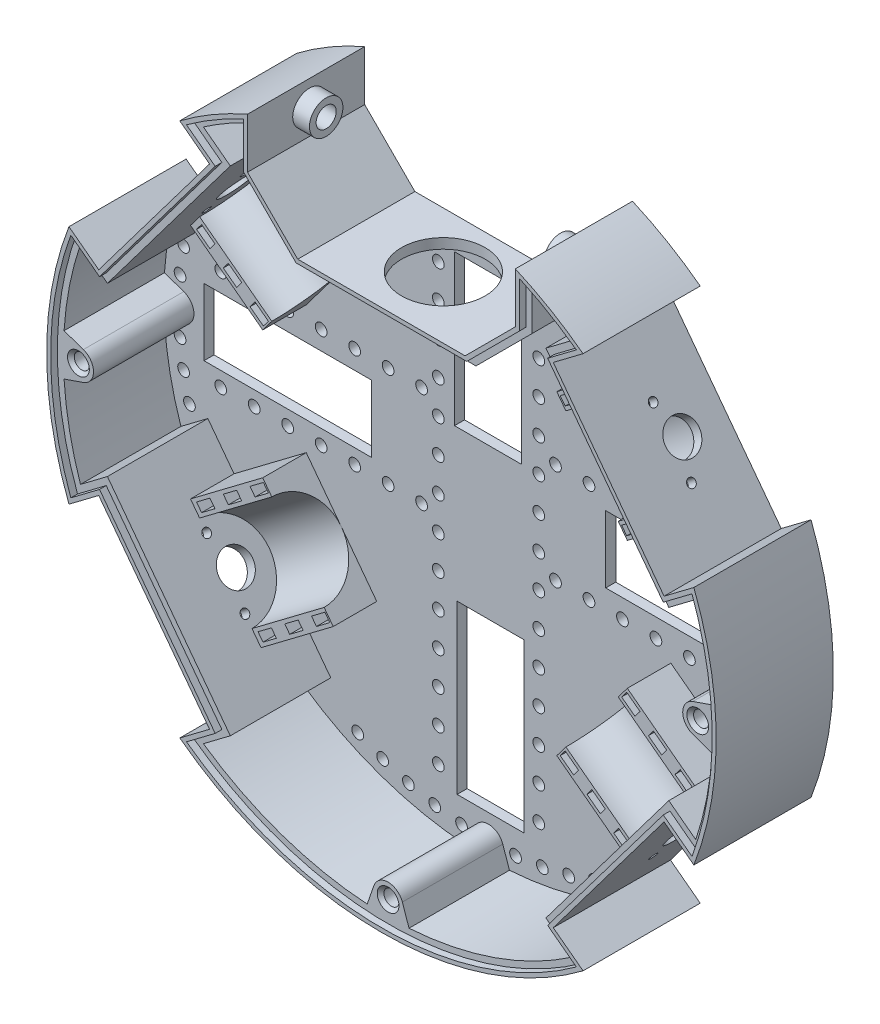
from build123d import *

# Parameters (mm, degrees)
SKETCH1_R                                    = 100
BOSS_EXTRUDE1_DEPTH                          = 3
CUT_EXTRUDE1_START                           = -3
CUT_EXTRUDE1_DEPTH                           = 3
CUT_EXTRUDE2_DEPTH                           = 3
BOSS_EXTRUDE2_DEPTH                          = 13
SKETCH5_R                                    = 13
CUT_EXTRUDE3_DEPTH                           = 50
CUT_EXTRUDE5_DEPTH                           = 143.323574997
LPATTERN1_COUNT                              = 3
LPATTERN1_PITCH                              = 10
CUT_EXTRUDE15_DEPTH                          = 2
MIRROR1_COPY_1_DEPTH                         = 143.323574997
MIRROR1_COPY_2_DEPTH                         = 143.323574997
MIRROR1_AT_THE_SECOND_PLANE_COPY_1_DEPTH     = 143.323574997
MIRROR1_AT_THE_SECOND_PLANE_COPY_2_DEPTH     = 143.323574997
MIRROR1_AT_THE_SECOND_PLANE_COPY_3_DEPTH     = 3
MIRROR1_AT_THE_SECOND_PLANE_COPY_4_DEPTH     = 13
MIRROR1_AT_THE_SECOND_PLANE_COPY_5_SKETC_R   = 13
MIRROR1_AT_THE_SECOND_PLANE_COPY_5_DEPTH     = 50
MIRROR1_AT_THE_SECOND_PLANE_COPY_6_DEPTH     = 143.323574997
MIRROR1_AT_THE_SECOND_PLANE_COPY_7_DEPTH     = 2
MIRROR1_AT_THE_SECOND_PLANE_COPY_8_DEPTH     = 143.323574997
MIRROR1_AT_THE_SECOND_PLANE_COPY_9_DEPTH     = 143.323574997
BOSS_EXTRUDE3_DEPTH                          = 30
BOSS_EXTRUDE3_DEPTH_BACK                     = 3
SKETCH14_R                                   = 1.25
SKETCH14_R_2                                 = 5
CUT_EXTRUDE6_DEPTH                           = 6
MIRROR2_AT_THE_SECOND_PLANE_COPY_1_SKETC_R   = 1.25
MIRROR2_AT_THE_SECOND_PLANE_COPY_1_SKETC_R_2 = 5
MIRROR2_AT_THE_SECOND_PLANE_COPY_1_DEPTH     = 6
SKETCH15_W                                   = 50
SKETCH15_H                                   = 20
SKETCH15_W_2                                 = 20
SKETCH15_H_2                                 = 50
SKETCH15_H_3                                 = 45
CUT_EXTRUDE7_DEPTH                           = 145.568322948
SKETCH19_R                                   = 1.75
CUT_EXTRUDE10_DEPTH                          = 145.568322948
CIRPATTERN2_COUNT                            = 4
CIRPATTERN2_ANGLE                            = 15
CIRPATTERN2_THE_OTHER_WAY_COUNT              = 4
CIRPATTERN2_THE_OTHER_WAY_ANGLE              = 15
MIRROR3_COPY_1_SKETCH_R                      = 1.75
MIRROR3_COPY_1_DEPTH                         = 145.568322948
MIRROR3_COPY_2_SKETCH_R                      = 1.75
MIRROR3_COPY_2_DEPTH                         = 145.568322948
MIRROR3_COPY_3_SKETCH_R                      = 1.75
MIRROR3_COPY_3_DEPTH                         = 145.568322948
MIRROR3_COPY_4_SKETCH_R                      = 1.75
MIRROR3_COPY_4_DEPTH                         = 145.568322948
MIRROR3_COPY_5_SKETCH_R                      = 1.75
MIRROR3_COPY_5_DEPTH                         = 145.568322948
MIRROR3_COPY_6_SKETCH_R                      = 1.75
MIRROR3_COPY_6_DEPTH                         = 145.568322948
SKETCH20_R                                   = 1.75
CUT_EXTRUDE11_DEPTH                          = 145.568322948
CIRPATTERN3_COUNT                            = 6
CIRPATTERN3_ANGLE                            = 25
CIRPATTERN3_THE_OTHER_WAY_COUNT              = 6
CIRPATTERN3_THE_OTHER_WAY_ANGLE              = 25
SKETCH23_R                                   = 1.75
CUT_EXTRUDE12_DEPTH                          = 145.568322948
SKETCH25_R                                   = 5
BOSS_EXTRUDE5_DEPTH                          = 5
SKETCH26_R                                   = 3
CUT_EXTRUDE13_DEPTH                          = 8
CUT_EXTRUDE14_DEPTH                          = 15
CUT_EXTRUDE14_DEPTH_BACK                     = 30
SKETCH28_R                                   = 12.5
SKETCH30_R                                   = 2.25
BOSS_EXTRUDE6_DEPTH                          = 30
CHAMFER2_SIZE                                = 1
CIRPATTERN4_COUNT                            = 3
CIRPATTERN4_ANGLE                            = 180
CHAMFER2_OF_CIRPATTERN4_SIZE                 = 1
BOSS_EXTRUDE7_DEPTH                          = 2
CHAMFER3_SIZE                                = 4


with BuildPart() as part:
    # Sketch1 → Boss-Extrude1 (new body)
    with BuildSketch(Plane.XY):
        Circle(SKETCH1_R)
    extrude(amount=BOSS_EXTRUDE1_DEPTH)

    # Sketch2 → Cut-Extrude1 (cut)
    with BuildSketch(Plane.XY.offset(3).offset(CUT_EXTRUDE1_START)):
        with BuildLine():
            Line((-40, 91.651513899), (-40, 76.651513899))
            Line((-40, 76.651513899), (-25, 61.651513899))
            Line((-25, 61.651513899), (25, 61.651513899))
            Line((25, 61.651513899), (40, 76.651513899))
            Line((40, 76.651513899), (40, 91.651513899))
            ThreePointArc((40, 91.651513899), (0, 100), (-40, 91.651513899))
        make_face()
    extrude(amount=CUT_EXTRUDE1_DEPTH, mode=Mode.SUBTRACT)

    # Sketch3 → Cut-Extrude2 (cut)
    with BuildSketch(Plane.XY.offset(3)):
        Polygon((51.334105217, 73.116753494), (84.433931491, 29.191800442), (108.392996792, 47.246251136), (75.293170519, 91.171204189), align=None)
    cut_extrude2 = extrude(amount=-CUT_EXTRUDE2_DEPTH, mode=Mode.SUBTRACT)

    # Sketch4 → Boss-Extrude2 (add)
    with BuildSketch(Plane.XY.offset(3)):
        Polygon((57.352255449, 65.130398394), (78.415781259, 37.178155542), (54.456715958, 19.123704848), (33.393190147, 47.075947699), align=None)
    boss_extrude2 = extrude(amount=BOSS_EXTRUDE2_DEPTH)

    # Sketch5 → Cut-Extrude3 (cut)
    with BuildSketch(Plane(origin=(67.884018354, 51.154276968, 0), x_dir=(0, 0, -1), z_dir=(0.7986355100472918, 0.6018150231520498, 0))):
        with Locations((-16, 0)):
            Circle(SKETCH5_R)
    cut_extrude3 = extrude(amount=-CUT_EXTRUDE3_DEPTH, mode=Mode.SUBTRACT)

    # Sketch9 → Cut-Extrude5 (cut, through all)
    with BuildSketch(Plane.XY.offset(16)):
        Polygon((68.722391333, 34.256137107), (72.715568883, 37.265212223), (74.220106441, 35.268623448), (70.226928891, 32.259548332), align=None)
        Polygon((50.38213908, 58.594473887), (54.37531663, 61.603549002), (55.849642281, 59.647052782), (51.856464731, 56.637977666), align=None)
    cut_extrude5 = extrude(amount=-CUT_EXTRUDE5_DEPTH, mode=Mode.SUBTRACT)

    # LPattern1: Cut-Extrude5 ×3
    with Locations(*[Vector(-0.7986355100472922, -0.6018150231520492, 0) * (i * LPATTERN1_PITCH) for i in range(1, LPATTERN1_COUNT)]):
        add(cut_extrude5, mode=Mode.SUBTRACT)

    # Sketch29 → Cut-Extrude15 (cut)
    with BuildSketch(Plane(origin=(0, 0, 0), x_dir=(-1, 0, 0), z_dir=(0, 0, -1))):
        Polygon((-68.722391333, 34.256137107), (-51.856464731, 56.637977666), (-55.849642281, 59.647052782), (-72.715568883, 37.265212223), align=None)
        Polygon((-60.736036232, 28.237986876), (-43.870109631, 50.619827434), (-47.863287181, 53.62890255), (-64.729213782, 31.247061992), align=None)
        Polygon((-52.749681132, 22.219836644), (-35.88375453, 44.601677203), (-39.87693208, 47.610752319), (-56.742858682, 25.22891176), align=None)
    cut_extrude15 = extrude(amount=-CUT_EXTRUDE15_DEPTH, mode=Mode.SUBTRACT)

    # Mirror1: Cut-Extrude2, Boss-Extrude2, Cut-Extrude3, Cut-Extrude5, Cut-Extrude15 across plane
    add(cut_extrude2.mirror(Plane(origin=(0, 0, 0), x_dir=(0, 0, 1), z_dir=(1, 0, 0))), mode=Mode.SUBTRACT)
    add(boss_extrude2.mirror(Plane(origin=(0, 0, 0), x_dir=(0, 0, 1), z_dir=(1, 0, 0))))
    add(cut_extrude3.mirror(Plane(origin=(0, 0, 0), x_dir=(0, 0, 1), z_dir=(1, 0, 0))), mode=Mode.SUBTRACT)
    add(cut_extrude5.mirror(Plane(origin=(0, 0, 0), x_dir=(0, 0, 1), z_dir=(1, 0, 0))), mode=Mode.SUBTRACT)
    add(cut_extrude15.mirror(Plane(origin=(0, 0, 0), x_dir=(0, 0, 1), z_dir=(1, 0, 0))), mode=Mode.SUBTRACT)

    # Mirror1 copy 1 sketch → Mirror1 copy 1 (cut, through all)
    with BuildSketch(Plane(origin=(7.9863551, -6.018150232, 16), x_dir=(-1, 0, 0), z_dir=(0, 0, 1))):
        Polygon((68.722391333, -34.256137107), (72.715568883, -37.265212223), (74.220106441, -35.268623448), (70.226928891, -32.259548332), align=None)
        Polygon((50.38213908, -58.594473887), (54.37531663, -61.603549002), (55.849642281, -59.647052782), (51.856464731, -56.637977666), align=None)
    extrude(amount=-MIRROR1_COPY_1_DEPTH, mode=Mode.SUBTRACT)

    # Mirror1 copy 2 sketch → Mirror1 copy 2 (cut, through all)
    with BuildSketch(Plane(origin=(15.972710201, -12.036300463, 16), x_dir=(-1, 0, 0), z_dir=(0, 0, 1))):
        Polygon((68.722391333, -34.256137107), (72.715568883, -37.265212223), (74.220106441, -35.268623448), (70.226928891, -32.259548332), align=None)
        Polygon((50.38213908, -58.594473887), (54.37531663, -61.603549002), (55.849642281, -59.647052782), (51.856464731, -56.637977666), align=None)
    extrude(amount=-MIRROR1_COPY_2_DEPTH, mode=Mode.SUBTRACT)

    # Mirror1 at the second plane: Cut-Extrude2, Boss-Extrude2, Cut-Extrude3, Cut-Extrude5, Cut-Extrude15 across plane
    add(cut_extrude2.mirror(Plane.ZX), mode=Mode.SUBTRACT)
    add(boss_extrude2.mirror(Plane.ZX))
    add(cut_extrude3.mirror(Plane.ZX), mode=Mode.SUBTRACT)
    add(cut_extrude5.mirror(Plane.ZX), mode=Mode.SUBTRACT)
    add(cut_extrude15.mirror(Plane.ZX), mode=Mode.SUBTRACT)

    # Mirror1 at the second plane copy 1 sketc → Mirror1 at the second plane copy 1 (cut, through all)
    with BuildSketch(Plane(origin=(-7.9863551, 6.018150232, 16), x_dir=(1, 0, 0), z_dir=(0, 0, 1))):
        Polygon((68.722391333, -34.256137107), (72.715568883, -37.265212223), (74.220106441, -35.268623448), (70.226928891, -32.259548332), align=None)
        Polygon((50.38213908, -58.594473887), (54.37531663, -61.603549002), (55.849642281, -59.647052782), (51.856464731, -56.637977666), align=None)
    extrude(amount=-MIRROR1_AT_THE_SECOND_PLANE_COPY_1_DEPTH, mode=Mode.SUBTRACT)

    # Mirror1 at the second plane copy 2 sketc → Mirror1 at the second plane copy 2 (cut, through all)
    with BuildSketch(Plane(origin=(-15.972710201, 12.036300463, 16), x_dir=(1, 0, 0), z_dir=(0, 0, 1))):
        Polygon((68.722391333, -34.256137107), (72.715568883, -37.265212223), (74.220106441, -35.268623448), (70.226928891, -32.259548332), align=None)
        Polygon((50.38213908, -58.594473887), (54.37531663, -61.603549002), (55.849642281, -59.647052782), (51.856464731, -56.637977666), align=None)
    extrude(amount=-MIRROR1_AT_THE_SECOND_PLANE_COPY_2_DEPTH, mode=Mode.SUBTRACT)

    # Mirror1 at the second plane copy 3 sketc → Mirror1 at the second plane copy 3 (cut)
    with BuildSketch(Plane(origin=(0, 0, 3), x_dir=(-1, 0, 0), z_dir=(0, 0, 1))):
        Polygon((51.334105217, 73.116753494), (84.433931491, 29.191800442), (108.392996792, 47.246251136), (75.293170519, 91.171204189), align=None)
    extrude(amount=-MIRROR1_AT_THE_SECOND_PLANE_COPY_3_DEPTH, mode=Mode.SUBTRACT)

    # Mirror1 at the second plane copy 4 sketc → Mirror1 at the second plane copy 4 (add)
    with BuildSketch(Plane(origin=(0, 0, 3), x_dir=(-1, 0, 0), z_dir=(0, 0, 1))):
        Polygon((57.352255449, 65.130398394), (78.415781259, 37.178155542), (54.456715958, 19.123704848), (33.393190147, 47.075947699), align=None)
    extrude(amount=MIRROR1_AT_THE_SECOND_PLANE_COPY_4_DEPTH)

    # Mirror1 at the second plane copy 5 sketc → Mirror1 at the second plane copy 5 (cut)
    with BuildSketch(Plane(origin=(-67.884018354, -51.154276968, 0), x_dir=(0, 0, -1), z_dir=(-0.7986355100472918, -0.6018150231520498, 0))):
        with Locations((-16, 0)):
            Circle(MIRROR1_AT_THE_SECOND_PLANE_COPY_5_SKETC_R)
    extrude(amount=-MIRROR1_AT_THE_SECOND_PLANE_COPY_5_DEPTH, mode=Mode.SUBTRACT)

    # Mirror1 at the second plane copy 6 sketc → Mirror1 at the second plane copy 6 (cut, through all)
    with BuildSketch(Plane(origin=(0, 0, 16), x_dir=(-1, 0, 0), z_dir=(0, 0, 1))):
        Polygon((68.722391333, 34.256137107), (72.715568883, 37.265212223), (74.220106441, 35.268623448), (70.226928891, 32.259548332), align=None)
        Polygon((50.38213908, 58.594473887), (54.37531663, 61.603549002), (55.849642281, 59.647052782), (51.856464731, 56.637977666), align=None)
    extrude(amount=-MIRROR1_AT_THE_SECOND_PLANE_COPY_6_DEPTH, mode=Mode.SUBTRACT)

    # Mirror1 at the second plane copy 7 sketc → Mirror1 at the second plane copy 7 (cut)
    with BuildSketch(Plane(origin=(0, 0, 0), x_dir=(1, 0, 0), z_dir=(0, 0, -1))):
        Polygon((-68.722391333, 34.256137107), (-51.856464731, 56.637977666), (-55.849642281, 59.647052782), (-72.715568883, 37.265212223), align=None)
        Polygon((-60.736036232, 28.237986876), (-43.870109631, 50.619827434), (-47.863287181, 53.62890255), (-64.729213782, 31.247061992), align=None)
        Polygon((-52.749681132, 22.219836644), (-35.88375453, 44.601677203), (-39.87693208, 47.610752319), (-56.742858682, 25.22891176), align=None)
    extrude(amount=-MIRROR1_AT_THE_SECOND_PLANE_COPY_7_DEPTH, mode=Mode.SUBTRACT)

    # Mirror1 at the second plane copy 8 sketc → Mirror1 at the second plane copy 8 (cut, through all)
    with BuildSketch(Plane(origin=(7.9863551, 6.018150232, 16), x_dir=(-1, 0, 0), z_dir=(0, 0, 1))):
        Polygon((68.722391333, 34.256137107), (72.715568883, 37.265212223), (74.220106441, 35.268623448), (70.226928891, 32.259548332), align=None)
        Polygon((50.38213908, 58.594473887), (54.37531663, 61.603549002), (55.849642281, 59.647052782), (51.856464731, 56.637977666), align=None)
    extrude(amount=-MIRROR1_AT_THE_SECOND_PLANE_COPY_8_DEPTH, mode=Mode.SUBTRACT)

    # Mirror1 at the second plane copy 9 sketc → Mirror1 at the second plane copy 9 (cut, through all)
    with BuildSketch(Plane(origin=(15.972710201, 12.036300463, 16), x_dir=(-1, 0, 0), z_dir=(0, 0, 1))):
        Polygon((68.722391333, 34.256137107), (72.715568883, 37.265212223), (74.220106441, 35.268623448), (70.226928891, 32.259548332), align=None)
        Polygon((50.38213908, 58.594473887), (54.37531663, 61.603549002), (55.849642281, 59.647052782), (51.856464731, 56.637977666), align=None)
    extrude(amount=-MIRROR1_AT_THE_SECOND_PLANE_COPY_9_DEPTH, mode=Mode.SUBTRACT)

    # Sketch13 → Boss-Extrude3 (add, two sides: drawn at the far end of the back side and taken through both)
    with BuildSketch(Plane.XY.offset(3).offset(-BOSS_EXTRUDE3_DEPTH_BACK)):
        with BuildLine():
            Line((-51.334105217, -73.116753494), (-60.234436857, -79.823634448))
            ThreePointArc((-60.234436857, -79.823634448), (0, -100), (60.234436857, -79.823634448))
            Line((60.234436857, -79.823634448), (51.334105217, -73.116753494))
            Line((51.334105217, -73.116753494), (84.433931491, -29.191800442))
            Line((84.433931491, -29.191800442), (93.33426313, -35.898681396))
            ThreePointArc((93.33426313, -35.898681396), (100, 0), (93.33426313, 35.898681396))
            Line((93.33426313, 35.898681396), (84.433931491, 29.191800442))
            Line((84.433931491, 29.191800442), (51.334105217, 73.116753494))
            Line((51.334105217, 73.116753494), (60.234436857, 79.823634448))
            ThreePointArc((60.234436857, 79.823634448), (50.46494096, 86.332437322), (40, 91.651513899))
            Line((40, 91.651513899), (40, 76.651513899))
            Line((40, 76.651513899), (25, 61.651513899))
            Line((25, 61.651513899), (-25, 61.651513899))
            Line((-25, 61.651513899), (-40, 76.651513899))
            Line((-40, 76.651513899), (-40, 91.651513899))
            ThreePointArc((-40, 91.651513899), (-50.46494096, 86.332437322), (-60.234436857, 79.823634448))
            Line((-60.234436857, 79.823634448), (-51.334105217, 73.116753494))
            Line((-51.334105217, 73.116753494), (-84.433931491, 29.191800442))
            Line((-84.433931491, 29.191800442), (-93.33426313, 35.898681396))
            ThreePointArc((-93.33426313, 35.898681396), (-100, 0), (-93.33426313, -35.898681396))
            Line((-93.33426313, -35.898681396), (-84.433931491, -29.191800442))
            Line((-84.433931491, -29.191800442), (-51.334105217, -73.116753494))
        make_face()
        with BuildLine():
            Line((-47.132753618, -73.707214955), (-55.183101904, -79.77358751))
            ThreePointArc((-55.183101904, -79.77358751), (0, -97), (55.183101904, -79.77358751))
            Line((55.183101904, -79.77358751), (47.132753618, -73.707214955))
            Line((47.132753618, -73.707214955), (83.84347003, -24.990448842))
            Line((83.84347003, -24.990448842), (91.893818316, -31.056821398))
            ThreePointArc((91.893818316, -31.056821398), (97, 0), (91.893818316, 31.056821398))
            Line((91.893818316, 31.056821398), (83.84347003, 24.990448842))
            Line((83.84347003, 24.990448842), (47.132753618, 73.707214955))
            Line((47.132753618, 73.707214955), (55.183101904, 79.77358751))
            ThreePointArc((55.183101904, 79.77358751), (49.222447703, 83.583195931), (43, 86.948260477))
            Line((43, 86.948260477), (43, 75.408873212))
            Line((43, 75.408873212), (26.242640687, 58.651513899))
            Line((26.242640687, 58.651513899), (-26.242640687, 58.651513899))
            Line((-26.242640687, 58.651513899), (-43, 75.408873212))
            Line((-43, 75.408873212), (-43, 86.948260477))
            ThreePointArc((-43, 86.948260477), (-49.222447703, 83.583195931), (-55.183101904, 79.77358751))
            Line((-55.183101904, 79.77358751), (-47.132753618, 73.707214955))
            Line((-47.132753618, 73.707214955), (-83.84347003, 24.990448842))
            Line((-83.84347003, 24.990448842), (-91.893818316, 31.056821398))
            ThreePointArc((-91.893818316, 31.056821398), (-97, 0), (-91.893818316, -31.056821398))
            Line((-91.893818316, -31.056821398), (-83.84347003, -24.990448842))
            Line((-83.84347003, -24.990448842), (-47.132753618, -73.707214955))
        make_face(mode=Mode.SUBTRACT)
    extrude(amount=BOSS_EXTRUDE3_DEPTH + BOSS_EXTRUDE3_DEPTH_BACK)

    # Sketch14 → Cut-Extrude6 (cut)
    with BuildSketch(Plane(origin=(67.884018354, -51.154276968, 0), x_dir=(0, 0, -1), z_dir=(0.7986355100472917, -0.6018150231520497, 0))):
        with Locations(Location((-16, 9.5, 0), (0, 0, 90))):
            Circle(SKETCH14_R)
        with Locations(Location((-16, -9.5, 0), (0, 0, 90))):
            Circle(SKETCH14_R)
        with Locations(Location((-13, 0, 0), (0, 0, 90))):
            Circle(SKETCH14_R_2)
    cut_extrude6 = extrude(amount=-CUT_EXTRUDE6_DEPTH, mode=Mode.SUBTRACT)

    # Mirror2: Cut-Extrude6 across plane
    add(cut_extrude6.mirror(Plane(origin=(0, 0, 0), x_dir=(0, 0, 1), z_dir=(1, 0, 0))), mode=Mode.SUBTRACT)

    # Mirror2 at the second plane: Cut-Extrude6 across plane
    add(cut_extrude6.mirror(Plane.ZX), mode=Mode.SUBTRACT)

    # Mirror2 at the second plane copy 1 sketc → Mirror2 at the second plane copy 1 (cut)
    with BuildSketch(Plane(origin=(-67.884018354, 51.154276968, 0), x_dir=(0, 0, -1), z_dir=(-0.7986355100472917, 0.6018150231520497, 0))):
        with Locations(Location((-16, 9.5, 0), (0, 0, 90))):
            Circle(MIRROR2_AT_THE_SECOND_PLANE_COPY_1_SKETC_R)
        with Locations(Location((-16, -9.5, 0), (0, 0, 90))):
            Circle(MIRROR2_AT_THE_SECOND_PLANE_COPY_1_SKETC_R)
        with Locations(Location((-13, 0, 0), (0, 0, 90))):
            Circle(MIRROR2_AT_THE_SECOND_PLANE_COPY_1_SKETC_R_2)
    extrude(amount=-MIRROR2_AT_THE_SECOND_PLANE_COPY_1_DEPTH, mode=Mode.SUBTRACT)

    # Sketch15 → Cut-Extrude7 (cut, through all)
    with BuildSketch(Plane.XY.offset(3)):
        with Locations((-60, -0.608916789)):
            Rectangle(SKETCH15_W, SKETCH15_H)
        with Locations((60, 0.608916789)):
            Rectangle(SKETCH15_W, SKETCH15_H)
        with Locations((0.608916789, -60)):
            Rectangle(SKETCH15_W_2, SKETCH15_H_2)
        with Locations((-0.173976225, 32.5)):
            Rectangle(SKETCH15_W_2, SKETCH15_H_3)
    extrude(amount=-CUT_EXTRUDE7_DEPTH, mode=Mode.SUBTRACT)

    # Sketch19 → Cut-Extrude10 (cut, through all)
    with BuildSketch(Plane.XY.offset(3)):
        with Locations((-92.5, 0)):
            Circle(SKETCH19_R)
    cut_extrude10 = extrude(amount=-CUT_EXTRUDE10_DEPTH, mode=Mode.SUBTRACT)

    # CirPattern2: Cut-Extrude10 ×4 about axis
    cirpattern2_axis = Axis((0, 0, 0), (0, 0, 1))
    for i in range(1, CIRPATTERN2_COUNT):
        add(cut_extrude10.rotate(cirpattern2_axis, i * CIRPATTERN2_ANGLE / (CIRPATTERN2_COUNT - 1)), mode=Mode.SUBTRACT)

    # CirPattern2 the other way: Cut-Extrude10 ×4 about axis
    cirpattern2_the_other_way_axis = Axis((0, 0, 0), (0, 0, -1))
    for i in range(1, CIRPATTERN2_THE_OTHER_WAY_COUNT):
        add(cut_extrude10.rotate(cirpattern2_the_other_way_axis, i * CIRPATTERN2_THE_OTHER_WAY_ANGLE / (CIRPATTERN2_THE_OTHER_WAY_COUNT - 1)), mode=Mode.SUBTRACT)

    # Mirror3: Cut-Extrude10 across plane
    add(cut_extrude10.mirror(Plane(origin=(0, 0, 0), x_dir=(0, 0, 1), z_dir=(1, 0, 0))), mode=Mode.SUBTRACT)

    # Mirror3 copy 1 sketch → Mirror3 copy 1 (cut, through all)
    with BuildSketch(Plane(origin=(0, 0, 3), x_dir=(-0.9961946980917455, 0.08715574274765837, 0), z_dir=(0, 0, 1))):
        with Locations((-92.5, 0)):
            Circle(MIRROR3_COPY_1_SKETCH_R)
    extrude(amount=-MIRROR3_COPY_1_DEPTH, mode=Mode.SUBTRACT)

    # Mirror3 copy 2 sketch → Mirror3 copy 2 (cut, through all)
    with BuildSketch(Plane(origin=(0, 0, 3), x_dir=(-0.984807753012208, 0.17364817766693075, 0), z_dir=(0, 0, 1))):
        with Locations((-92.5, 0)):
            Circle(MIRROR3_COPY_2_SKETCH_R)
    extrude(amount=-MIRROR3_COPY_2_DEPTH, mode=Mode.SUBTRACT)

    # Mirror3 copy 3 sketch → Mirror3 copy 3 (cut, through all)
    with BuildSketch(Plane(origin=(0, 0, 3), x_dir=(-0.9659258262890681, 0.2588190451025214, 0), z_dir=(0, 0, 1))):
        with Locations((-92.5, 0)):
            Circle(MIRROR3_COPY_3_SKETCH_R)
    extrude(amount=-MIRROR3_COPY_3_DEPTH, mode=Mode.SUBTRACT)

    # Mirror3 copy 4 sketch → Mirror3 copy 4 (cut, through all)
    with BuildSketch(Plane(origin=(0, 0, 3), x_dir=(-0.9961946980917455, -0.08715574274765837, 0), z_dir=(0, 0, 1))):
        with Locations((-92.5, 0)):
            Circle(MIRROR3_COPY_4_SKETCH_R)
    extrude(amount=-MIRROR3_COPY_4_DEPTH, mode=Mode.SUBTRACT)

    # Mirror3 copy 5 sketch → Mirror3 copy 5 (cut, through all)
    with BuildSketch(Plane(origin=(0, 0, 3), x_dir=(-0.984807753012208, -0.17364817766693075, 0), z_dir=(0, 0, 1))):
        with Locations((-92.5, 0)):
            Circle(MIRROR3_COPY_5_SKETCH_R)
    extrude(amount=-MIRROR3_COPY_5_DEPTH, mode=Mode.SUBTRACT)

    # Mirror3 copy 6 sketch → Mirror3 copy 6 (cut, through all)
    with BuildSketch(Plane(origin=(0, 0, 3), x_dir=(-0.9659258262890681, -0.2588190451025214, 0), z_dir=(0, 0, 1))):
        with Locations((-92.5, 0)):
            Circle(MIRROR3_COPY_6_SKETCH_R)
    extrude(amount=-MIRROR3_COPY_6_DEPTH, mode=Mode.SUBTRACT)

    # Sketch20 → Cut-Extrude11 (cut, through all)
    with BuildSketch(Plane.XY.offset(3)):
        with Locations((0, -92.5)):
            Circle(SKETCH20_R)
    cut_extrude11 = extrude(amount=-CUT_EXTRUDE11_DEPTH, mode=Mode.SUBTRACT)

    # CirPattern3: Cut-Extrude11 ×6 about axis
    cirpattern3_axis = Axis((0, 0, 0), (0, 0, 1))
    for i in range(1, CIRPATTERN3_COUNT):
        add(cut_extrude11.rotate(cirpattern3_axis, i * CIRPATTERN3_ANGLE / (CIRPATTERN3_COUNT - 1)), mode=Mode.SUBTRACT)

    # CirPattern3 the other way: Cut-Extrude11 ×6 about axis
    cirpattern3_the_other_way_axis = Axis((0, 0, 0), (0, 0, -1))
    for i in range(1, CIRPATTERN3_THE_OTHER_WAY_COUNT):
        add(cut_extrude11.rotate(cirpattern3_the_other_way_axis, i * CIRPATTERN3_THE_OTHER_WAY_ANGLE / (CIRPATTERN3_THE_OTHER_WAY_COUNT - 1)), mode=Mode.SUBTRACT)

    # Sketch23 → Cut-Extrude12 (cut, through all)
    with BuildSketch(Plane.XY.offset(3)):
        with Locations((-50, 15)):
            Circle(SKETCH23_R)
        with Locations((-50, -15)):
            Circle(SKETCH23_R)
        with Locations((50, -15)):
            Circle(SKETCH23_R)
        with Locations((50, 15)):
            Circle(SKETCH23_R)
        with Locations((-15, -50)):
            Circle(SKETCH23_R)
        with Locations((15, -50)):
            Circle(SKETCH23_R)
        with Locations((-60, 15)):
            Circle(SKETCH23_R)
        with Locations((-60, -15)):
            Circle(SKETCH23_R)
        with Locations((-70, 15)):
            Circle(SKETCH23_R)
        with Locations((-70, -15)):
            Circle(SKETCH23_R)
        with Locations((-80, 15)):
            Circle(SKETCH23_R)
        with Locations((-80, -15)):
            Circle(SKETCH23_R)
        with Locations(Location((80, -15, 0), (0, 0, 180))):
            Circle(SKETCH23_R)
        with Locations(Location((80, 15, 0), (0, 0, 180))):
            Circle(SKETCH23_R)
        with Locations(Location((70, -15, 0), (0, 0, 180))):
            Circle(SKETCH23_R)
        with Locations(Location((70, 15, 0), (0, 0, 180))):
            Circle(SKETCH23_R)
        with Locations(Location((60, -15, 0), (0, 0, 180))):
            Circle(SKETCH23_R)
        with Locations(Location((60, 15, 0), (0, 0, 180))):
            Circle(SKETCH23_R)
        with Locations((-15, -40)):
            Circle(SKETCH23_R)
        with Locations((15, -40)):
            Circle(SKETCH23_R)
        with Locations((-15, -30)):
            Circle(SKETCH23_R)
        with Locations((15, -30)):
            Circle(SKETCH23_R)
        with Locations((-15, -20)):
            Circle(SKETCH23_R)
        with Locations((15, -20)):
            Circle(SKETCH23_R)
        with Locations((-15, -10)):
            Circle(SKETCH23_R)
        with Locations((15, -10)):
            Circle(SKETCH23_R)
        with Locations((-15, 0)):
            Circle(SKETCH23_R)
        with Locations((15, 0)):
            Circle(SKETCH23_R)
        with Locations((-15, 10)):
            Circle(SKETCH23_R)
        with Locations((15, 10)):
            Circle(SKETCH23_R)
        with Locations((-15, 20)):
            Circle(SKETCH23_R)
        with Locations((15, 20)):
            Circle(SKETCH23_R)
        with Locations((-15, 30)):
            Circle(SKETCH23_R)
        with Locations((15, 30)):
            Circle(SKETCH23_R)
        with Locations((-15, 40)):
            Circle(SKETCH23_R)
        with Locations((15, 40)):
            Circle(SKETCH23_R)
        with Locations((-15, 50)):
            Circle(SKETCH23_R)
        with Locations((15, 50)):
            Circle(SKETCH23_R)
        with Locations((-15, -60)):
            Circle(SKETCH23_R)
        with Locations((15, -60)):
            Circle(SKETCH23_R)
        with Locations((-15, -70)):
            Circle(SKETCH23_R)
        with Locations((15, -70)):
            Circle(SKETCH23_R)
        with Locations((-15, -80)):
            Circle(SKETCH23_R)
        with Locations((15, -80)):
            Circle(SKETCH23_R)
        with Locations((-40, 15)):
            Circle(SKETCH23_R)
        with Locations((-40, -15)):
            Circle(SKETCH23_R)
        with Locations((-30, 15)):
            Circle(SKETCH23_R)
        with Locations((-30, -15)):
            Circle(SKETCH23_R)
        with Locations((-20, 15)):
            Circle(SKETCH23_R)
        with Locations((-20, -15)):
            Circle(SKETCH23_R)
        with Locations((40, 15)):
            Circle(SKETCH23_R)
        with Locations((40, -15)):
            Circle(SKETCH23_R)
        with Locations((30, 15)):
            Circle(SKETCH23_R)
        with Locations((30, -15)):
            Circle(SKETCH23_R)
        with Locations((20, 15)):
            Circle(SKETCH23_R)
        with Locations((20, -15)):
            Circle(SKETCH23_R)
    extrude(amount=-CUT_EXTRUDE12_DEPTH, mode=Mode.SUBTRACT)

    # Sketch25 → Boss-Extrude5 (add)
    with BuildSketch(Plane.ZY.offset(-40)):
        with Locations(Location((16.5, 84.151513899, 0), (0, 0, 90))):
            Circle(SKETCH25_R)
    boss_extrude5 = extrude(amount=BOSS_EXTRUDE5_DEPTH)

    # Sketch26 → Cut-Extrude13 (cut)
    with BuildSketch(Plane.ZY.offset(-35)):
        with Locations(Location((16.5, 84.151513899, 0), (0, 0, 270))):
            Circle(SKETCH26_R)
    cut_extrude13 = extrude(amount=-CUT_EXTRUDE13_DEPTH, mode=Mode.SUBTRACT)

    # Mirror4: Boss-Extrude5, Cut-Extrude13 across plane
    add(boss_extrude5.mirror(Plane(origin=(0, 0, 0), x_dir=(0, 0, 1), z_dir=(1, 0, 0))))
    add(cut_extrude13.mirror(Plane(origin=(0, 0, 0), x_dir=(0, 0, 1), z_dir=(1, 0, 0))), mode=Mode.SUBTRACT)

    # Sketch28 → Cut-Extrude14 (cut, two sides: drawn at the far end of the back side and taken through both)
    with BuildSketch(Plane.XZ.offset(-61.651513899).offset(-CUT_EXTRUDE14_DEPTH_BACK)):
        with Locations(Location((0, 16.5, 0), (0, 0, 90))):
            Circle(SKETCH28_R)
    extrude(amount=CUT_EXTRUDE14_DEPTH + CUT_EXTRUDE14_DEPTH_BACK, mode=Mode.SUBTRACT)

    # Sketch30 → Boss-Extrude6 (add)
    with BuildSketch(Plane.XY.offset(3)):
        with BuildLine():
            Line((-91.027933765, 4.25241355), (-96.798437487, 6.25))
            ThreePointArc((-96.798437487, 6.25), (-97, 0), (-96.798437487, -6.25))
            Line((-96.798437487, -6.25), (-91.027933765, -4.25241355))
            ThreePointArc((-91.027933765, -4.25241355), (-88, 0), (-91.027933765, 4.25241355))
        make_face()
        with Locations((-92.5, 0)):
            Circle(SKETCH30_R, mode=Mode.SUBTRACT)
    boss_extrude6 = extrude(amount=BOSS_EXTRUDE6_DEPTH)

    # Chamfer2
    chamfer2_edges = [part.edges().sort_by_distance(p)[0] for p in [
        (-94.75, 0, 33),
    ]]
    chamfer(chamfer2_edges, length=CHAMFER2_SIZE)

    # CirPattern4: Boss-Extrude6 ×3 about axis
    cirpattern4_axis = Axis((0, 0, 0), (0, 0, 1))
    for i in range(1, CIRPATTERN4_COUNT):
        add(boss_extrude6.rotate(cirpattern4_axis, i * CIRPATTERN4_ANGLE / (CIRPATTERN4_COUNT - 1)))

    # Chamfer2 of CirPattern4
    chamfer2_of_cirpattern4_edges = [part.edges().sort_by_distance(p)[0] for p in [
        (0, -94.75, 33),
        (94.75, 0, 33),
    ]]
    chamfer(chamfer2_of_cirpattern4_edges, length=CHAMFER2_OF_CIRPATTERN4_SIZE)

    # Sketch31 → Boss-Extrude7 (add)
    with BuildSketch(Plane.XY.offset(33)):
        with BuildLine():
            Line((60.234436857, -79.823634448), (51.334105217, -73.116753494))
            Line((51.334105217, -73.116753494), (84.433931491, -29.191800442))
            Line((84.433931491, -29.191800442), (93.33426313, -35.898681396))
            ThreePointArc((93.33426313, -35.898681396), (100, 0), (93.33426313, 35.898681396))
            Line((93.33426313, 35.898681396), (84.433931491, 29.191800442))
            Line((84.433931491, 29.191800442), (51.334105217, 73.116753494))
            Line((51.334105217, 73.116753494), (60.234436857, 79.823634448))
            ThreePointArc((60.234436857, 79.823634448), (50.46494096, 86.332437322), (40, 91.651513899))
            Line((40, 91.651513899), (40, 76.651513899))
            Line((40, 76.651513899), (25, 61.651513899))
            Line((25, 61.651513899), (-25, 61.651513899))
            Line((-25, 61.651513899), (-40, 76.651513899))
            Line((-40, 76.651513899), (-40, 91.651513899))
            ThreePointArc((-40, 91.651513899), (-50.46494096, 86.332437322), (-60.234436857, 79.823634448))
            Line((-60.234436857, 79.823634448), (-51.334105217, 73.116753494))
            Line((-51.334105217, 73.116753494), (-84.433931491, 29.191800442))
            Line((-84.433931491, 29.191800442), (-93.33426313, 35.898681396))
            ThreePointArc((-93.33426313, 35.898681396), (-100, 0), (-93.33426313, -35.898681396))
            Line((-93.33426313, -35.898681396), (-84.433931491, -29.191800442))
            Line((-84.433931491, -29.191800442), (-51.334105217, -73.116753494))
            Line((-51.334105217, -73.116753494), (-60.234436857, -79.823634448))
            ThreePointArc((-60.234436857, -79.823634448), (0, -100), (60.234436857, -79.823634448))
        make_face()
        with BuildLine():
            Line((58.230649769, -79.816235363), (49.653564577, -73.352938078))
            Line((49.653564577, -73.352938078), (84.197746906, -27.511259802))
            Line((84.197746906, -27.511259802), (92.774832098, -33.974557086))
            ThreePointArc((92.774832098, -33.974557086), (98.8, 0), (92.774832098, 33.974557086))
            Line((92.774832098, 33.974557086), (84.197746906, 27.511259802))
            Line((84.197746906, 27.511259802), (49.653564577, 73.352938078))
            Line((49.653564577, 73.352938078), (58.230649769, 79.816235363))
            ThreePointArc((58.230649769, 79.816235363), (49.965301017, 85.234433736), (41.2, 89.799777283))
            Line((41.2, 89.799777283), (41.2, 76.154457624))
            Line((41.2, 76.154457624), (25.497056275, 60.451513899))
            Line((25.497056275, 60.451513899), (-25.497056275, 60.451513899))
            Line((-25.497056275, 60.451513899), (-41.2, 76.154457624))
            Line((-41.2, 76.154457624), (-41.2, 89.799777283))
            ThreePointArc((-41.2, 89.799777283), (-49.965301017, 85.234433736), (-58.230649769, 79.816235363))
            Line((-58.230649769, 79.816235363), (-49.653564577, 73.352938078))
            Line((-49.653564577, 73.352938078), (-84.197746906, 27.511259802))
            Line((-84.197746906, 27.511259802), (-92.774832098, 33.974557086))
            ThreePointArc((-92.774832098, 33.974557086), (-98.8, 0), (-92.774832098, -33.974557086))
            Line((-92.774832098, -33.974557086), (-84.197746906, -27.511259802))
            Line((-84.197746906, -27.511259802), (-49.653564577, -73.352938078))
            Line((-49.653564577, -73.352938078), (-58.230649769, -79.816235363))
            ThreePointArc((-58.230649769, -79.816235363), (0, -98.8), (58.230649769, -79.816235363))
        make_face(mode=Mode.SUBTRACT)
    extrude(amount=BOSS_EXTRUDE7_DEPTH)

    # Chamfer3
    chamfer3_edges = [part.edges().sort_by_distance(p)[0] for p in [
        (62.732625007, 29.742524434, 2),
        (45.866698406, 52.124364992, 2),
        (54.746269907, 23.724374202, 2),
        (37.880343305, 46.106214761, 2),
        (70.718980108, 35.760674665, 2),
        (53.853053506, 58.142515224, 2),
        (62.732625007, -29.742524434, 2),
        (45.866698406, -52.124364992, 2),
        (54.746269907, -23.724374202, 2),
        (37.880343305, -46.106214761, 2),
        (70.718980108, -35.760674665, 2),
        (53.853053506, -58.142515224, 2),
        (-62.732625007, 29.742524434, 2),
        (-45.866698406, 52.124364992, 2),
        (-54.746269907, 23.724374202, 2),
        (-37.880343305, 46.106214761, 2),
        (-70.718980108, 35.760674665, 2),
        (-53.853053506, 58.142515224, 2),
        (-62.732625007, -29.742524434, 2),
        (-45.866698406, -52.124364992, 2),
        (-54.746269907, -23.724374202, 2),
        (-37.880343305, -46.106214761, 2),
        (-70.718980108, -35.760674665, 2),
        (-53.853053506, -58.142515224, 2),
    ]]
    chamfer(chamfer3_edges, length=CHAMFER3_SIZE)


solid = part.part
